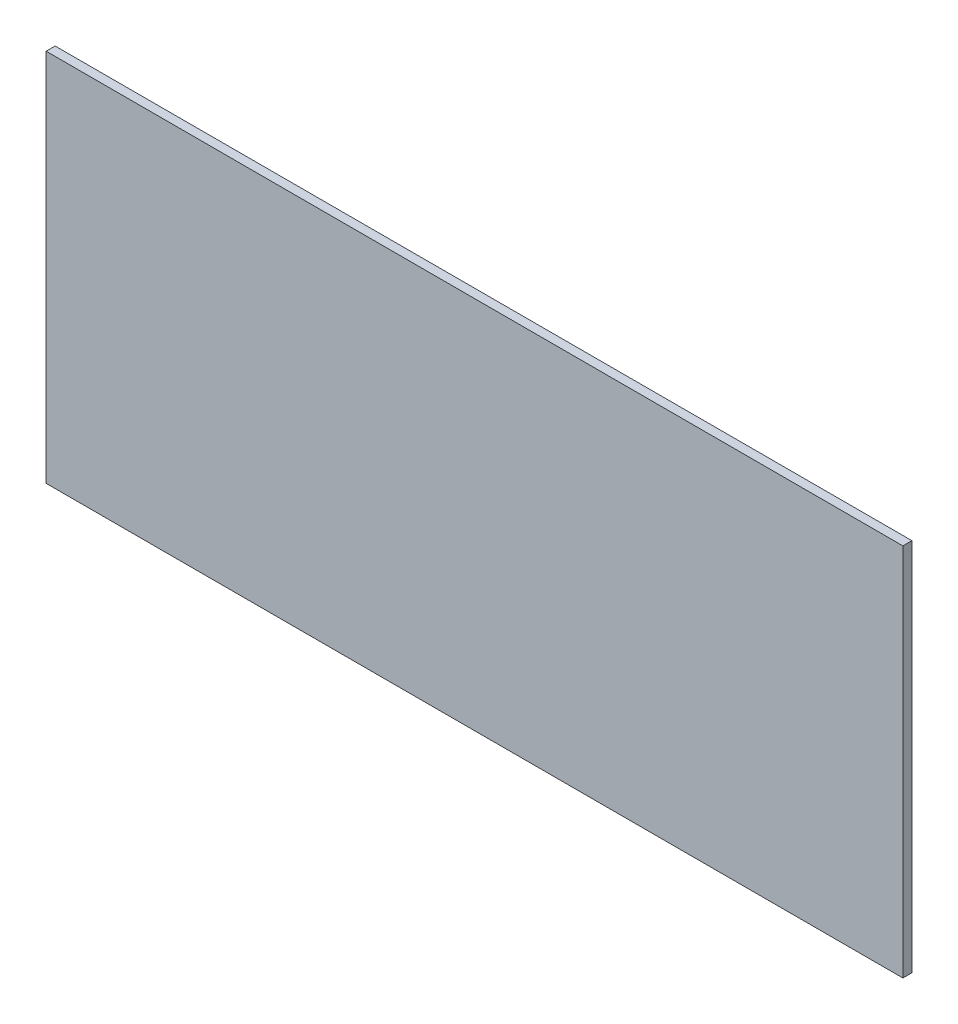
from build123d import *

# Parameters (mm, degrees)
ESQUISSE1_W        = 380
ESQUISSE1_H        = 166
BOSS_EXTRU_1_DEPTH = 4


with BuildPart() as part:
    # Esquisse1 → Boss.-Extru.1 (new body)
    with BuildSketch(Plane.XY):
        with Locations((-18.46713993, -30.169642857)):
            Rectangle(ESQUISSE1_W, ESQUISSE1_H)
    extrude(amount=BOSS_EXTRU_1_DEPTH)


solid = part.part
